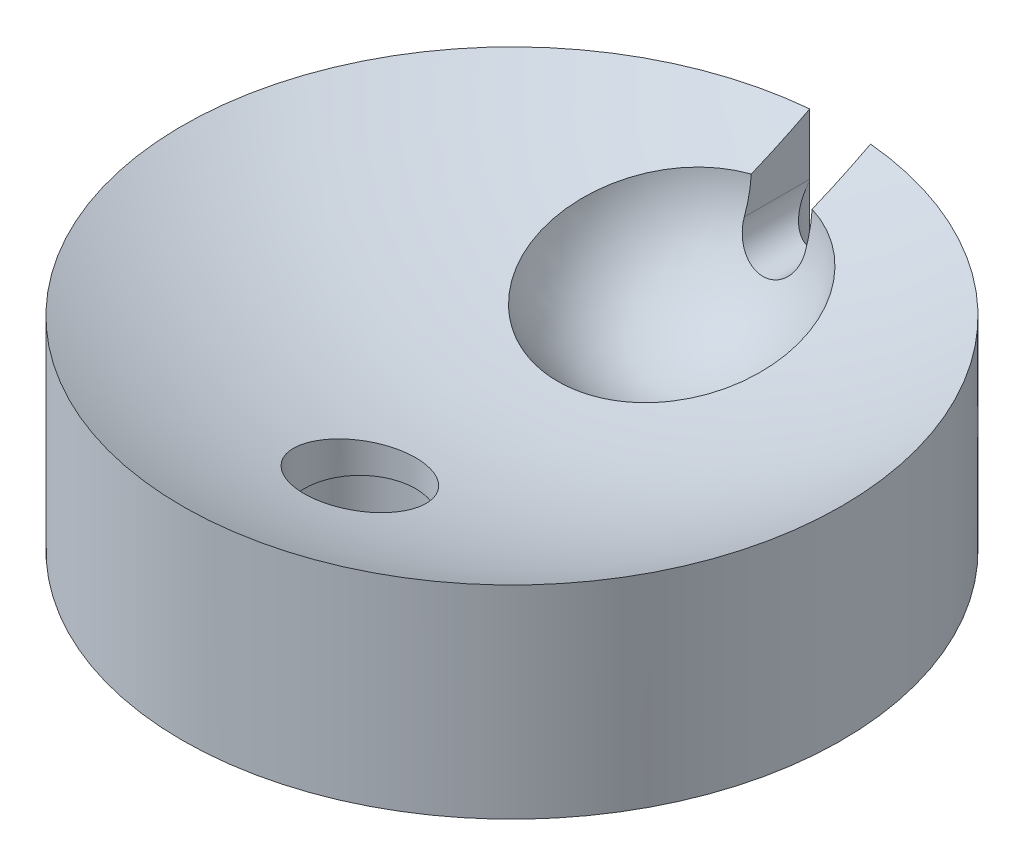
from build123d import *

# Parameters (mm, degrees)
WIRE_PASSTHRU_DEPTH        = 51.124844139
WIRE_PASSTHRU_PT2_DEPTH    = 56.646203941
SKETCH6_R                  = 5.5
CAMERA_LENS_CUT_PT1_DEPTH  = 51.124844309
SKETCH8_R                  = 6
CAMERA_LENS_CUT_PT2_DEPTH  = 10
SKETCH9_W                  = 15
SKETCH9_H                  = 15
CAMERA_PCB_CUT_DEPTH       = 2
SKETCH10_W                 = 21
SKETCH10_H                 = 6
ALIGNMENT_PEG_CUTOUT_DEPTH = 6
FILLET1_R                  = 1.5


with BuildPart() as part:
    # Sketch1 → BASE (revolve)
    with BuildSketch(Plane.XY):
        with BuildLine():
            Line((0, 0), (0, 12))
            ThreePointArc((0, 12), (16.735067971, 14.029411367), (32.5, 20))
            Line((32.5, 20), (32.5, 0))
            Line((32.5, 0), (0, 0))
        make_face()
    revolve(axis=Axis((0, 0, 0), (0, 1, 0)))

    # Sketch2 → WIRE PASSTHRU (cut, through all)
    with BuildSketch(Plane.XZ):
        with BuildLine():
            ThreePointArc((-2.99680303, -32.361538462), (0, -29.5), (2.99680303, -32.361538462))
            ThreePointArc((2.99680303, -32.361538462), (0, -32.5), (-2.99680303, -32.361538462))
        make_face()
    extrude(amount=-WIRE_PASSTHRU_DEPTH, mode=Mode.SUBTRACT)

    # Sketch3 → DEPLOYMENT CHARGE CAVITY (revolve, cut)
    with BuildSketch(Plane(origin=(0, 0, 0), x_dir=(0, 0, -1), z_dir=(1, 0, 0))):
        with BuildLine():
            Line((15, 18), (15, 6))
            ThreePointArc((15, 6), (23.485281374, 9.514718626), (27, 18))
            Line((27, 18), (15, 18))
        make_face()
    revolve(axis=Axis((0, 18, -15), (0, -1, 0)), mode=Mode.SUBTRACT)

    # Sketch5 → WIRE PASSTHRU PT2 (cut, through all)
    with BuildSketch(Plane.XY.offset(-8)):
        with BuildLine():
            Line((-3, 14), (-3, 20))
            Line((-3, 20), (3, 20))
            Line((3, 20), (3, 14))
            ThreePointArc((3, 14), (0, 11), (-3, 14))
        make_face()
    extrude(amount=-WIRE_PASSTHRU_PT2_DEPTH, mode=Mode.SUBTRACT)

    # Sketch6 → CAMERA LENS CUT PT1 (cut, through all)
    with BuildSketch(Plane.XZ):
        with Locations((0, 15)):
            Circle(SKETCH6_R)
    extrude(amount=-CAMERA_LENS_CUT_PT1_DEPTH, mode=Mode.SUBTRACT)

    # Sketch8 → CAMERA LENS CUT PT2 (cut)
    with BuildSketch(Plane.XZ):
        with Locations((0, 15)):
            Circle(SKETCH8_R)
    extrude(amount=-CAMERA_LENS_CUT_PT2_DEPTH, mode=Mode.SUBTRACT)

    # Sketch9 → CAMERA PCB CUT (cut)
    with BuildSketch(Plane.XZ):
        with Locations((0, 15)):
            Rectangle(SKETCH9_W, SKETCH9_H)
    extrude(amount=-CAMERA_PCB_CUT_DEPTH, mode=Mode.SUBTRACT)

    # Sketch10 → ALIGNMENT PEG CUTOUT (cut)
    with BuildSketch(Plane.XZ):
        with Locations((0, -20)):
            Rectangle(SKETCH10_W, SKETCH10_H)
    extrude(amount=-ALIGNMENT_PEG_CUTOUT_DEPTH, mode=Mode.SUBTRACT)

    # Fillet1
    fillet1_edges = [part.edges().sort_by_distance(p)[0] for p in [
        (10.5, 0, -20),
        (0, 0, -23),
        (-10.5, 0, -20),
        (0, 0, -17),
    ]]
    fillet(fillet1_edges, radius=FILLET1_R)


solid = part.part
